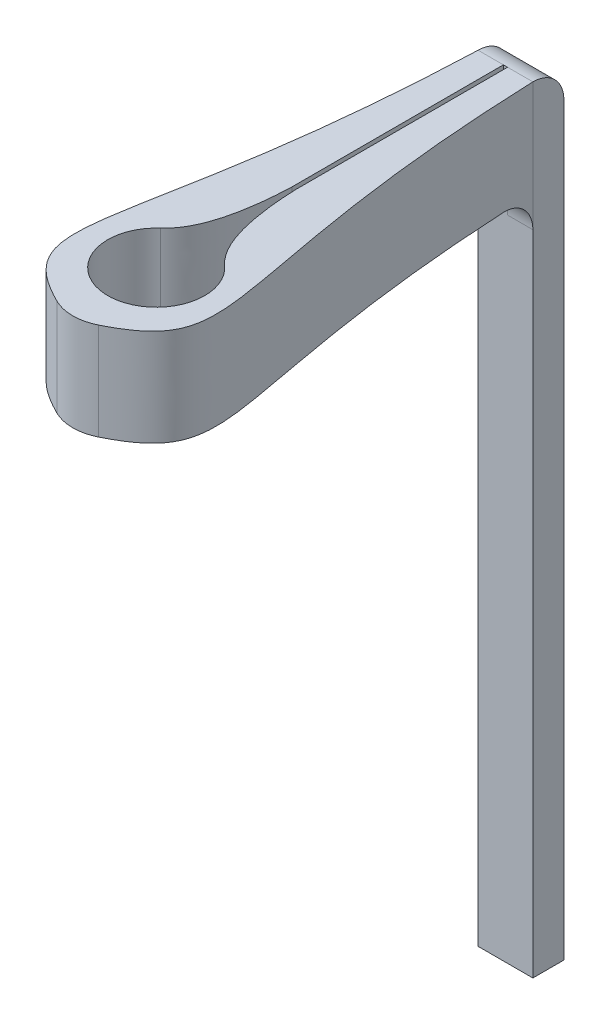
from build123d import *

# Parameters (mm, degrees)
BOSS_EXTRUDE1_DEPTH      = 1.5875
BOSS_EXTRUDE1_DEPTH_BACK = 1.5875
FILLET1_R                = 1.524
BOSS_EXTRUDE2_DEPTH      = 0.89581
BOSS_EXTRUDE2_DEPTH_BACK = 0.89581
FILLET2_R                = 1.016


with BuildPart() as part:
    # Sketch1 → Boss-Extrude1 (new, two sides: drawn at the far end of the back side and taken through both)
    with BuildSketch(Plane(origin=(0, 0, 0), x_dir=(1, 0, 0), z_dir=(0, 1, 0)).offset(-BOSS_EXTRUDE1_DEPTH_BACK)):
        with BuildLine():
            Line((-0.068296764, 6.214618695), (-0.068296764, 13.138711739))
            Line((-0.068296764, 13.138711739), (-0.895808533, 13.138711739))
            add(Edge.make_bspline(
                [(-0.895808533, 13.138711739), (-1.210074473, 4.57087153), (-2.777608758, 1.083562638), (-3.277136157, 0.201945645), (0, -1.169953638)],
                knots=[0, 0, 0, 0, 0, 1, 1, 1, 1, 1], degree=4))
            add(Edge.make_bspline(
                [(0.895808533, 13.138711739), (1.210074473, 4.57087153), (2.777608758, 1.083562638), (3.277136157, 0.201945645), (0, -1.169953638)],
                knots=[0, 0, 0, 0, 0, 1, 1, 1, 1, 1], degree=4))
            Line((0.895808533, 13.138711739), (0.068296764, 13.138711739))
            Line((0.068296764, 13.138711739), (0.068296764, 6.214618695))
            add(Edge.make_bspline(
                [(1.054098961, 2.89573812), (0.161537854, 3.688347072), (0.068296764, 6.214618695)],
                knots=[0, 0, 0, 1, 1, 1], degree=2))
            ThreePointArc((1.054098961, 2.89573812), (0, 0.121211739), (-1.054098961, 2.89573812))
            add(Edge.make_bspline(
                [(-1.054098961, 2.89573812), (-0.161537854, 3.688347072), (-0.068296764, 6.214618695)],
                knots=[0, 0, 0, 1, 1, 1], degree=2))
        make_face()
    extrude(amount=BOSS_EXTRUDE1_DEPTH + BOSS_EXTRUDE1_DEPTH_BACK)

    # Fillet1
    fillet1_edges = [part.edges().sort_by_distance(p)[0] for p in [
        (0, -0.79375, 1.169953638),
    ]]
    fillet(fillet1_edges, radius=FILLET1_R)

    # Sketch2 → Boss-Extrude2 (add, two sides: drawn at the far end of the back side and taken through both)
    with BuildSketch(Plane(origin=(0, 0, 0), x_dir=(0, 0, -1), z_dir=(1, 0, 0)).offset(-BOSS_EXTRUDE2_DEPTH_BACK)):
        Polygon((13.138711739, 1.5875), (13.138711739, -1.5875), (13.138711739, -23.8125), (14.154711739, -23.8125), (14.154711739, 1.5875), align=None)
    extrude(amount=BOSS_EXTRUDE2_DEPTH + BOSS_EXTRUDE2_DEPTH_BACK)

    # Fillet2
    fillet2_edges = [part.edges().sort_by_distance(p)[0] for p in [
        (0, 1.5875, -14.154711739),
        (0.482052648, -1.5875, -13.138711739),
        (-0.482052648, -1.5875, -13.138711739),
    ]]
    fillet(fillet2_edges, radius=FILLET2_R - 0.0001)  # a hair under: the kernel refuses the full size


solid = part.part
